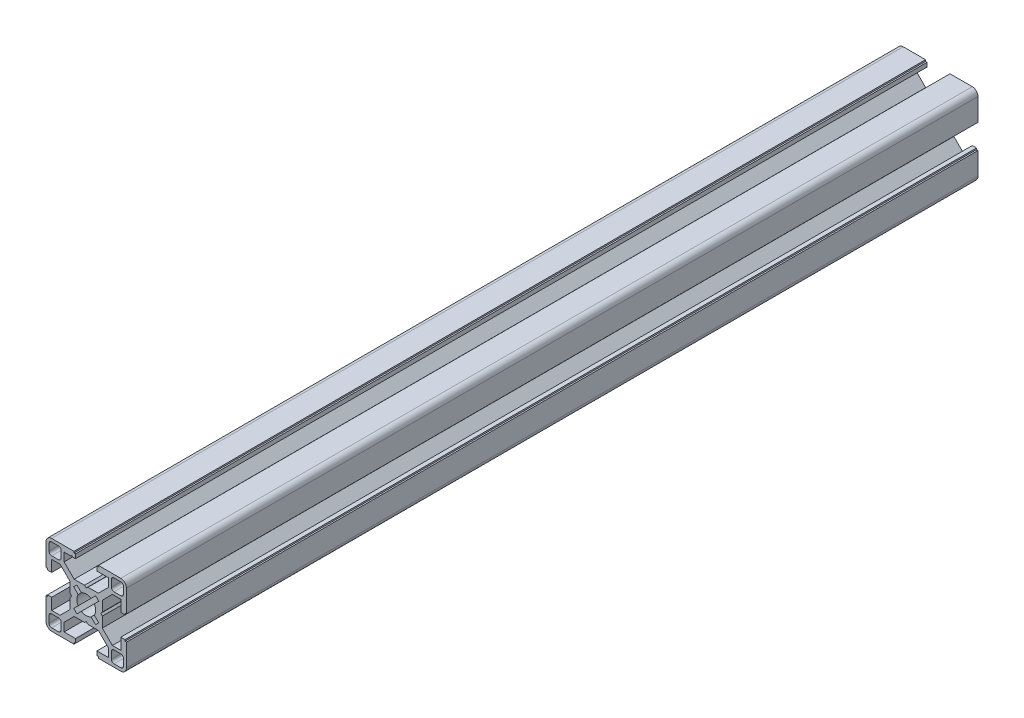
from build123d import *

# Parameters (mm, degrees)
BOSS_EXTRUDE1_DEPTH     = 317.5
CUT_EXTRUDE1_DEPTH      = 319.20787231
CUT_EXTRUDE1_DEPTH_BACK = 319.20787231


with BuildPart() as part:
    # Sketch4 → Boss-Extrude1 (new body)
    with BuildSketch(Plane.XY):
        with BuildLine():
            Line((0, -5.45), (0.655464476, -6))
            Line((0.655464476, -6), (4.504469158, -6))
            Line((4.504469158, -6), (8.25, -9.745530842))
            Line((8.25, -9.745530842), (8.25, -12.885))
            Line((8.25, -12.885), (4, -12.885))
            Line((4, -12.885), (4, -14.45))
            Line((4, -14.45), (4.55, -14.45))
            Line((4.55, -14.45), (4.55, -15))
            Line((4.55, -15), (12.885, -15))
            ThreePointArc((12.885, -15), (14.380530842, -14.380530842), (15, -12.885))
            Line((15, -12.885), (15, -4.55))
            Line((15, -4.55), (14.45, -4.55))
            Line((14.45, -4.55), (14.45, -4))
            Line((14.45, -4), (12.885, -4))
            Line((12.885, -4), (12.885, -8.25))
            Line((12.885, -8.25), (9.745530842, -8.25))
            Line((9.745530842, -8.25), (6, -4.504469158))
            Line((6, -4.504469158), (6, -0.655464476))
            Line((6, -0.655464476), (5.45, 0))
            Line((5.45, 0), (3.5, 0))
            ThreePointArc((3.5, 0), (3.371433308, -0.939913534), (2.995178599, -1.81077474))
            Line((2.995178599, -1.81077474), (4.675743591, -3.491339732))
            Line((4.675743591, -3.491339732), (3.491339732, -4.675743591))
            Line((3.491339732, -4.675743591), (1.81077474, -2.995178599))
            ThreePointArc((1.81077474, -2.995178599), (0.939913534, -3.371433308), (0, -3.5))
            Line((0, -3.5), (0, -5.45))
        make_face()
        with BuildLine():
            Line((9.375, -10.365), (9.375, -12.885))
            ThreePointArc((9.375, -12.885), (9.664964287, -13.585035713), (10.365, -13.875))
            Line((10.365, -13.875), (12.885, -13.875))
            ThreePointArc((12.885, -13.875), (13.585035713, -13.585035713), (13.875, -12.885))
            Line((13.875, -12.885), (13.875, -10.365))
            ThreePointArc((13.875, -10.365), (13.585035713, -9.664964287), (12.885, -9.375))
            Line((12.885, -9.375), (10.365, -9.375))
            ThreePointArc((10.365, -9.375), (9.664964287, -9.664964287), (9.375, -10.365))
        make_face(mode=Mode.SUBTRACT)
    extrude(amount=BOSS_EXTRUDE1_DEPTH)

    # Mirror1: part across plane


with BuildPart() as part_1:
    add(part.part)
    add(part.part.mirror(Plane(origin=(0, 0, 0), x_dir=(0, 0, 1), z_dir=(1, 0, 0))))

    # Mirror2: part across plane


with BuildPart() as part_2:
    add(part_1.part)
    add(part_1.part.mirror(Plane.ZX))

    # Sketch5 → Cut-Extrude1 (cut, two sides: drawn at the far end of the back side and taken through both)
    with BuildSketch(Plane.XY.offset(317.5).offset(-CUT_EXTRUDE1_DEPTH_BACK)):
        Polygon((-5.675, 12.885), (-5.4, 13.16), (-5.125, 12.885), align=None)
    extrude(amount=CUT_EXTRUDE1_DEPTH + CUT_EXTRUDE1_DEPTH_BACK, mode=Mode.SUBTRACT)


solid = part_2.part
